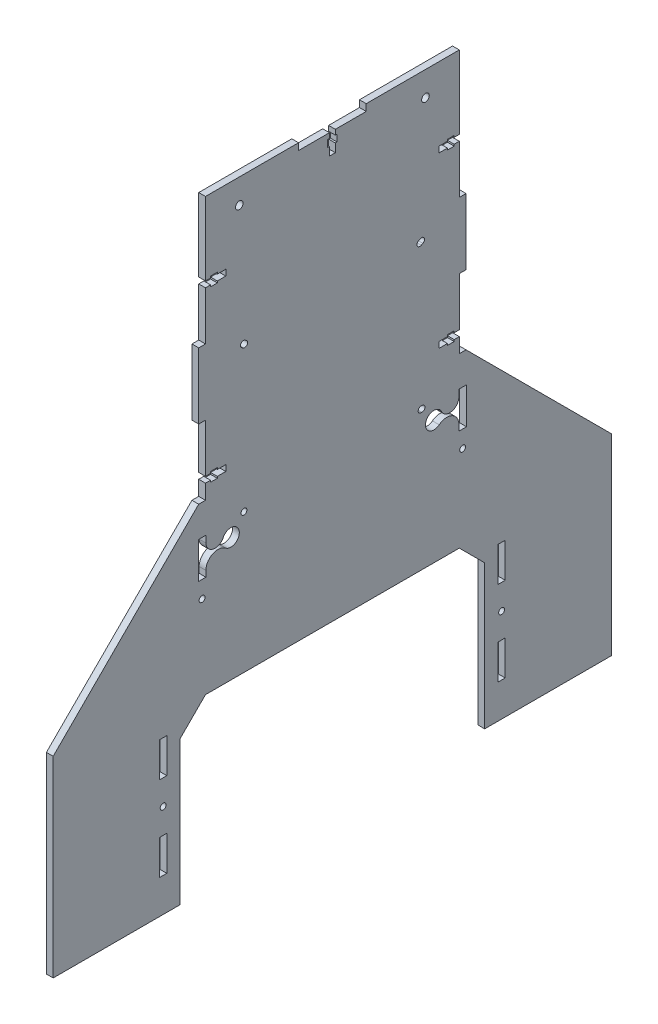
from build123d import *

# Parameters (mm, degrees)
SKETCH1_W           = 150
SKETCH1_H           = 255
BASE_FLANGE1_DEPTH  = 4
CUT_EXTRUDE1_DEPTH  = 266.830773237
SKETCH5_W           = 4
SKETCH5_H           = 39
TAB1_DEPTH          = 4
SKETCH6_R           = 2.25
CUT_EXTRUDE2_DEPTH  = 267.986891064
TAB2_DEPTH          = 4
SKETCH8_R           = 1.75
CUT_EXTRUDE3_DEPTH  = 392.492017799
SKETCH10_R          = 1.75
SKETCH10_W          = 4.3
SKETCH10_H          = 20.5
CUT_EXTRUDE5_DEPTH  = 392.492017799
CUT_EXTRUDE6_DEPTH  = 392.492017799
SKETCH12_W          = 4.5
SKETCH12_H          = 21.5
CUT_EXTRUDE7_DEPTH  = 392.492017799
SKETCH14_R          = 1.75
CUT_EXTRUDE9_DEPTH  = 392.492017799
CUT_EXTRUDE11_DEPTH = 392.492017799
CUT_EXTRUDE12_DEPTH = 392.492017799


# Sheet-metal steps are written as plain solids
with BuildPart() as part:
    # Sketch1 → Base-Flange1 (new body)
    with BuildSketch(Plane(origin=(0, 0, 0), x_dir=(0, 0, -1), z_dir=(1, 0, 0))):
        with Locations((0, -127.5)):
            Rectangle(SKETCH1_W, SKETCH1_H)
    extrude(amount=-BASE_FLANGE1_DEPTH)

    # Sketch4 → Cut-Extrude1 (cut, through all)
    with BuildSketch(Plane(origin=(0, 0, 0), x_dir=(0, 0, -1), z_dir=(1, 0, 0))):
        Polygon((-75, -43.25), (-75, -46.75), (-72, -46.75), (-72, -47.75), (-68, -47.75), (-68, -46.75), (-63, -46.75), (-63, -43.25), (-68, -43.25), (-68, -42.25), (-72, -42.25), (-72, -43.25), align=None)
        Polygon((-72, -146.75), (-75, -146.75), (-75, -143.25), (-72, -143.25), (-72, -142.25), (-68, -142.25), (-68, -143.25), (-63, -143.25), (-63, -146.75), (-68, -146.75), (-68, -147.75), (-72, -147.75), align=None)
        Polygon((75, -146.75), (75, -143.25), (72, -143.25), (72, -142.25), (68, -142.25), (68, -143.25), (63, -143.25), (63, -146.75), (68, -146.75), (68, -147.75), (72, -147.75), (72, -146.75), align=None)
        Polygon((72, -43.25), (75, -43.25), (75, -46.75), (72, -46.75), (72, -47.75), (68, -47.75), (68, -46.75), (63, -46.75), (63, -43.25), (68, -43.25), (68, -42.25), (72, -42.25), align=None)
    extrude(amount=-CUT_EXTRUDE1_DEPTH, mode=Mode.SUBTRACT)

    # Sketch5 → Tab1 (add)
    with BuildSketch(Plane(origin=(0, 0, 0), x_dir=(0, 0, -1), z_dir=(1, 0, 0))):
        with Locations((-77, -95)):
            Rectangle(SKETCH5_W, SKETCH5_H)
        with Locations((77, -95)):
            Rectangle(SKETCH5_W, SKETCH5_H)
    extrude(amount=-TAB1_DEPTH)

    # Sketch6 → Cut-Extrude2 (cut, through all)
    with BuildSketch(Plane(origin=(0, 0, 0), x_dir=(0, 0, -1), z_dir=(1, 0, 0))):
        with Locations((-55, -14.5)):
            Circle(SKETCH6_R)
        with Locations(Location((55, -14.5, 0), (0, 0, 180))):
            Circle(SKETCH6_R)
    extrude(amount=-CUT_EXTRUDE2_DEPTH, mode=Mode.SUBTRACT)

    # Sketch7 → Tab2 (add)
    with BuildSketch(Plane(origin=(0, 0, 0), x_dir=(0, 0, -1), z_dir=(1, 0, 0))):
        Polygon((-75, -255), (-90, -270), (-90, -355), (-165, -355), (-165, -241.5), (-79, -155.5), (-75, -155.5), align=None)
        Polygon((75, -155.5), (75, -255), (90, -270), (90, -355), (165, -355), (165, -241.5), (79, -155.5), align=None)
    extrude(amount=-TAB2_DEPTH)

    # Sketch8 → Cut-Extrude3 (cut, through all)
    with BuildSketch(Plane(origin=(0, 0, 0), x_dir=(0, 0, -1), z_dir=(1, 0, 0))):
        with Locations((-77, -205)):
            Circle(SKETCH8_R)
        with Locations((77, -205)):
            Circle(SKETCH8_R)
    extrude(amount=-CUT_EXTRUDE3_DEPTH, mode=Mode.SUBTRACT)

    # Sketch10 → Cut-Extrude5 (cut, through all)
    with BuildSketch(Plane(origin=(0, 0, 0), x_dir=(0, 0, -1), z_dir=(1, 0, 0))):
        with Locations((-100, -299.75)):
            Circle(SKETCH10_R)
        with Locations((100, -299.75)):
            Circle(SKETCH10_R)
        with Locations((-100, -324.75)):
            Rectangle(SKETCH10_W, SKETCH10_H)
        with Locations((-100, -274.75)):
            Rectangle(SKETCH10_W, SKETCH10_H)
        with Locations((100, -274.75)):
            Rectangle(SKETCH10_W, SKETCH10_H)
        with Locations((100, -324.75)):
            Rectangle(SKETCH10_W, SKETCH10_H)
    extrude(amount=-CUT_EXTRUDE5_DEPTH, mode=Mode.SUBTRACT)

    # Sketch11 → Cut-Extrude6 (cut, through all)
    with BuildSketch(Plane(origin=(0, 0, 0), x_dir=(0, 0, -1), z_dir=(1, 0, 0))):
        Polygon((-20, 0), (-20, -4), (-1.75, -4), (-1.75, -7), (-2.75, -7), (-2.75, -11), (-1.75, -11), (-1.75, -16), (1.75, -16), (1.75, -11), (2.75, -11), (2.75, -7), (1.75, -7), (1.75, -4), (20, -4), (20, 0), align=None)
    extrude(amount=-CUT_EXTRUDE6_DEPTH, mode=Mode.SUBTRACT)

    # Sketch12 → Cut-Extrude7 (cut, through all)
    with BuildSketch(Plane(origin=(0, 0, 0), x_dir=(0, 0, -1), z_dir=(1, 0, 0))):
        with Locations((-77, -184.25)):
            Rectangle(SKETCH12_W, SKETCH12_H)
        with Locations((77, -184.25)):
            Rectangle(SKETCH12_W, SKETCH12_H)
    extrude(amount=-CUT_EXTRUDE7_DEPTH, mode=Mode.SUBTRACT)

    # Sketch14 → Cut-Extrude9 (cut, through all)
    with BuildSketch(Plane(origin=(-4, 0, 0), x_dir=(0, 1, 0), z_dir=(-1, 0, 0))):
        with Locations(Location((-172.7, 52.45, 0), (0, 0, 270))):
            Circle(SKETCH14_R)
        with Locations(Location((-172.7, -52.25, 0), (0, 0, 270))):
            Circle(SKETCH14_R)
        with Locations(Location((-86.7, -52.55, 0), (0, 0, 270))):
            Circle(SKETCH14_R)
        with Locations(Location((-87.2, 51.75, 0), (0, 0, 270))):
            Circle(SKETCH14_R)
    extrude(amount=-CUT_EXTRUDE9_DEPTH, mode=Mode.SUBTRACT)

    # Sketch16 → Cut-Extrude11 (cut, through all)
    with BuildSketch(Plane(origin=(0, 0, 0), x_dir=(0, 0, -1), z_dir=(1, 0, 0))):
        with BuildLine():
            Line((-74.75, -177.5), (-74.75, -191.5))
            ThreePointArc((-74.75, -191.5), (-70.693771456, -185.047817237), (-63.121014964, -185.906310995))
            ThreePointArc((-63.121014964, -185.906310995), (-55.125270956, -180.887787453), (-64.506473724, -179.833968012))
            ThreePointArc((-64.506473724, -179.833968012), (-70.559234361, -182.753028585), (-74.75, -177.5))
        make_face()
        with BuildLine():
            Line((74.75, -177.5), (74.75, -191.5))
            ThreePointArc((74.75, -191.5), (70.693771456, -185.047817237), (63.121014964, -185.906310995))
            ThreePointArc((63.121014964, -185.906310995), (55.125270956, -180.887787453), (64.506473724, -179.833968012))
            ThreePointArc((64.506473724, -179.833968012), (70.559234361, -182.753028585), (74.75, -177.5))
        make_face()
    extrude(amount=-CUT_EXTRUDE11_DEPTH, mode=Mode.SUBTRACT)

    # Sketch17 → Cut-Extrude12 (cut, through all)
    with BuildSketch(Plane(origin=(0, 0, 0), x_dir=(0, 0, -1), z_dir=(1, 0, 0))):
        with BuildLine():
            Line((52.45, -170.95), (52.95, -170.95))
            ThreePointArc((52.95, -170.95), (54.7, -172.7), (52.95, -174.45))
            Line((52.95, -174.45), (52.45, -174.45))
            ThreePointArc((52.45, -174.45), (50.7, -172.7), (52.45, -170.95))
        make_face()
        with BuildLine():
            Line((-51.532833161, -85.275966425), (-50.832833161, -85.775966425))
            ThreePointArc((-50.832833161, -85.775966425), (-50.425966425, -88.217166839), (-52.867166839, -88.624033575))
            Line((-52.867166839, -88.624033575), (-53.567166839, -88.124033575))
            ThreePointArc((-53.567166839, -88.124033575), (-53.974033575, -85.682833161), (-51.532833161, -85.275966425))
        make_face()
        with BuildLine():
            Line((50.967376208, -85.634752416), (51.967376208, -85.134752416))
            ThreePointArc((51.967376208, -85.134752416), (54.315247584, -85.917376208), (53.532623792, -88.265247584))
            Line((53.532623792, -88.265247584), (52.532623792, -88.765247584))
            ThreePointArc((52.532623792, -88.765247584), (50.184752416, -87.982623792), (50.967376208, -85.634752416))
        make_face()
    extrude(amount=-CUT_EXTRUDE12_DEPTH, mode=Mode.SUBTRACT)


solid = part.part
